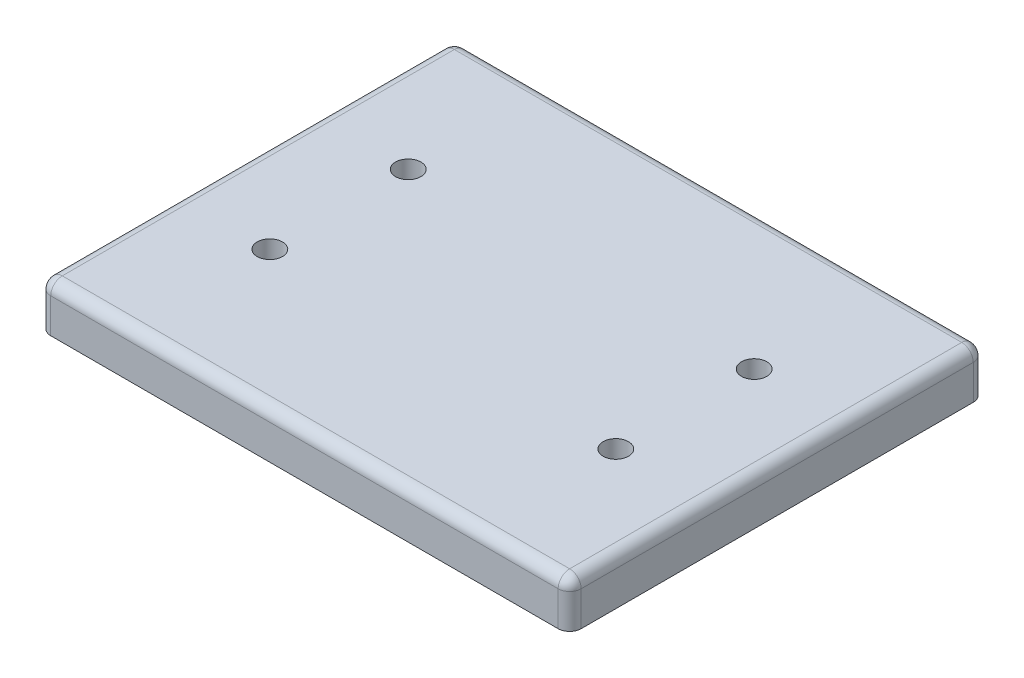
from build123d import *

# Parameters (mm, degrees)
SKETCH1_W               = 230
SKETCH1_H               = 180
BOSS_EXTRUDE1_DEPTH     = 20
FILLET1_R               = 5
SKETCH2_R               = 9
CUT_EXTRUDE1_DEPTH      = 10
SKETCH2_3_R             = 5.5
CUT_EXTRUDE2_DEPTH      = 148.39402973
MIRROR2_COPY_1_SKETCH_R = 9
MIRROR2_COPY_1_DEPTH    = 10
MIRROR2_COPY_2_SKETCH_R = 5.5
MIRROR2_COPY_2_DEPTH    = 148.39402973
FILLET2_R               = 5


with BuildPart() as part:
    # Sketch1 → Boss-Extrude1 (new body)
    with BuildSketch(Plane(origin=(0, 0, 0), x_dir=(1, 0, 0), z_dir=(0, 1, 0))):
        Rectangle(SKETCH1_W, SKETCH1_H)
    extrude(amount=BOSS_EXTRUDE1_DEPTH)

    # Fillet1
    fillet1_edges = [part.edges().sort_by_distance(p)[0] for p in [
        (-115, 20, 0),
        (0, 20, 90),
        (115, 20, 0),
        (0, 20, -90),
    ]]
    fillet(fillet1_edges, radius=FILLET1_R)

    # Sketch2 → Cut-Extrude1 (cut)
    with BuildSketch(Plane.XZ):
        with Locations(Location((-75, 30, 0), (0, 0, 270))):
            Circle(SKETCH2_R)
    cut_extrude1 = extrude(amount=-CUT_EXTRUDE1_DEPTH, mode=Mode.SUBTRACT)

    # Sketch2<3> → Cut-Extrude2 (cut, through all)
    with BuildSketch(Plane.XZ):
        with Locations(Location((-75, 30, 0), (0, 0, 270))):
            Circle(SKETCH2_3_R)
    cut_extrude2 = extrude(amount=-CUT_EXTRUDE2_DEPTH, mode=Mode.SUBTRACT)

    # Mirror1: Cut-Extrude1, Cut-Extrude2 across plane
    add(cut_extrude1.mirror(Plane(origin=(0, 0, 0), x_dir=(0, 0, 1), z_dir=(1, 0, 0))), mode=Mode.SUBTRACT)
    add(cut_extrude2.mirror(Plane(origin=(0, 0, 0), x_dir=(0, 0, 1), z_dir=(1, 0, 0))), mode=Mode.SUBTRACT)

    # Mirror2: Cut-Extrude1, Cut-Extrude2 across plane
    add(cut_extrude1.mirror(Plane.XY), mode=Mode.SUBTRACT)
    add(cut_extrude2.mirror(Plane.XY), mode=Mode.SUBTRACT)

    # Mirror2 copy 1 sketch → Mirror2 copy 1 (cut)
    with BuildSketch(Plane(origin=(0, 0, 0), x_dir=(-1, 0, 0), z_dir=(0, -1, 0))):
        with Locations(Location((-75, 30, 0), (0, 0, 270))):
            Circle(MIRROR2_COPY_1_SKETCH_R)
    extrude(amount=-MIRROR2_COPY_1_DEPTH, mode=Mode.SUBTRACT)

    # Mirror2 copy 2 sketch → Mirror2 copy 2 (cut, through all)
    with BuildSketch(Plane(origin=(0, 0, 0), x_dir=(-1, 0, 0), z_dir=(0, -1, 0))):
        with Locations(Location((-75, 30, 0), (0, 0, 270))):
            Circle(MIRROR2_COPY_2_SKETCH_R)
    extrude(amount=-MIRROR2_COPY_2_DEPTH, mode=Mode.SUBTRACT)

    # Fillet2
    # the kernel refuses this fillet: 5 mm, written as the material it takes off along each edge
    with BuildSketch(Plane(origin=(-110, 15, -85), x_dir=(-1, 0, 0), z_dir=(0, 0, -1))) as fillet2_piece_1_section:
        Polygon((0, 0), (FILLET2_R, 0), (FILLET2_R, FILLET2_R), (0, FILLET2_R), align=None)
    fillet2_piece_1 = extrude(amount=FILLET2_R, mode=Mode.PRIVATE)
    fillet2_piece_1 = fillet2_piece_1 - Plane(origin=(-110, 15, -85), x_dir=(0.7071067811865475, -0.7071067811865475, 0), z_dir=(0, 0, -1)) * Sphere(FILLET2_R, mode=Mode.PRIVATE)
    add(fillet2_piece_1, mode=Mode.SUBTRACT)
    with BuildSketch(Plane(origin=(110, 15, -85), x_dir=(1, 0, 0), z_dir=(0, 0, -1))) as fillet2_piece_2_section:
        Polygon((0, 0), (FILLET2_R, 0), (FILLET2_R, -FILLET2_R), (0, -FILLET2_R), align=None)
    fillet2_piece_2 = extrude(amount=FILLET2_R, mode=Mode.PRIVATE)
    fillet2_piece_2 = fillet2_piece_2 - Plane(origin=(110, 15, -85), x_dir=(-0.7071067811865475, -0.7071067811865475, 0), z_dir=(0, 0, -1)) * Sphere(FILLET2_R, mode=Mode.PRIVATE)
    add(fillet2_piece_2, mode=Mode.SUBTRACT)
    with BuildSketch(Plane(origin=(-110, 15, 85), x_dir=(0, 0, 1), z_dir=(-1, 0, 0))) as fillet2_piece_3_section:
        Polygon((0, 0), (FILLET2_R, 0), (FILLET2_R, FILLET2_R), (0, FILLET2_R), align=None)
    fillet2_piece_3 = extrude(amount=FILLET2_R, mode=Mode.PRIVATE)
    fillet2_piece_3 = fillet2_piece_3 - Plane(origin=(-110, 15, 85), x_dir=(0, -0.7071067811865475, -0.7071067811865475), z_dir=(-1, 0, 0)) * Sphere(FILLET2_R, mode=Mode.PRIVATE)
    add(fillet2_piece_3, mode=Mode.SUBTRACT)
    with BuildSketch(Plane(origin=(110, 15, 85), x_dir=(0, 0, 1), z_dir=(1, 0, 0))) as fillet2_piece_4_section:
        Polygon((0, 0), (FILLET2_R, 0), (FILLET2_R, -FILLET2_R), (0, -FILLET2_R), align=None)
    fillet2_piece_4 = extrude(amount=FILLET2_R, mode=Mode.PRIVATE)
    fillet2_piece_4 = fillet2_piece_4 - Plane(origin=(110, 15, 85), x_dir=(0, -0.7071067811865475, -0.7071067811865475), z_dir=(1, 0, 0)) * Sphere(FILLET2_R, mode=Mode.PRIVATE)
    add(fillet2_piece_4, mode=Mode.SUBTRACT)
    with BuildSketch(Plane(origin=(115, -12.5, 90), x_dir=(0, 0, -1), z_dir=(0, 1, 0)), Plane(origin=(115, -12.5, -90), x_dir=(-1, 0, 0), z_dir=(0, 1, 0))) as fillet2_piece_5:
        with BuildLine():
            CenterArc((FILLET2_R, FILLET2_R), FILLET2_R, 180, 90)
            Line((0, FILLET2_R), (0, 0))
            Line((0, 0), (FILLET2_R, 0))
        make_face()
    extrude(amount=27.5, mode=Mode.SUBTRACT)
    with BuildSketch(Plane(origin=(-115, -12.5, 90), x_dir=(0, 0, -1), z_dir=(0, 1, 0)), Plane(origin=(-115, -12.5, -90), x_dir=(1, 0, 0), z_dir=(0, 1, 0))) as fillet2_piece_6:
        with BuildLine():
            CenterArc((FILLET2_R, -FILLET2_R), FILLET2_R, 90, 90)
            Line((0, -FILLET2_R), (0, 0))
            Line((0, 0), (FILLET2_R, 0))
        make_face()
    extrude(amount=27.5, mode=Mode.SUBTRACT)


solid = part.part
